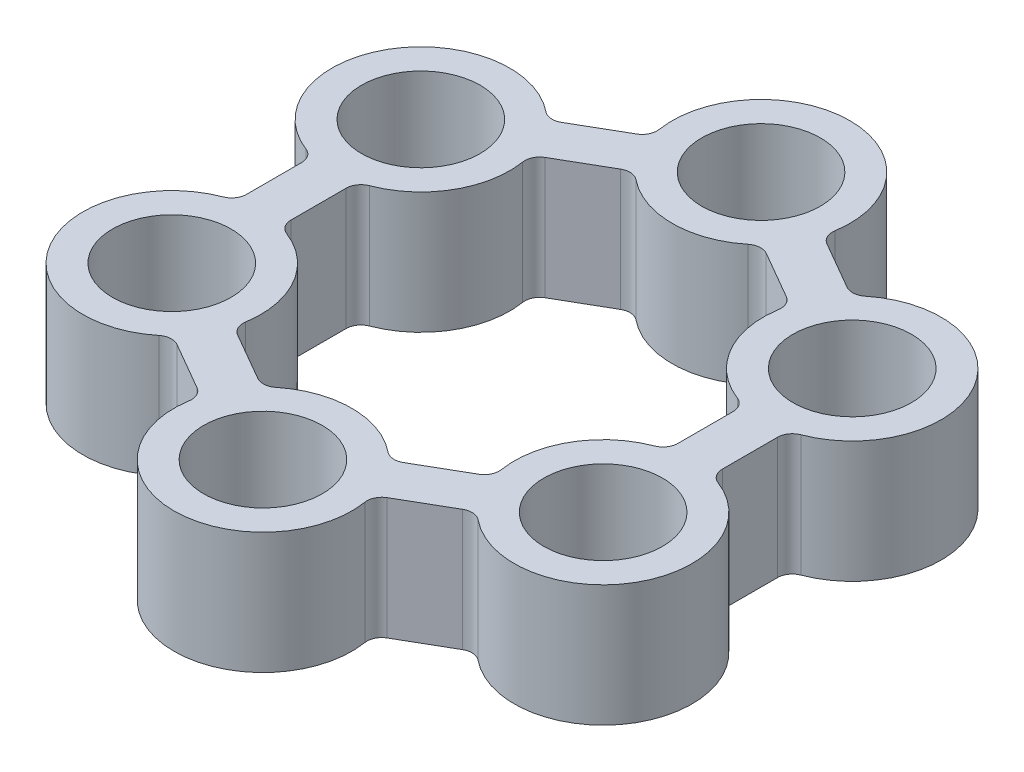
from build123d import *

# Parameters (mm, degrees)
SKETCH1_R           = 3
SKETCH1_R_2         = 2
BOSS_EXTRUDE1_DEPTH = 2.05
CIRPATTERN7_COUNT   = 6
BOSS_EXTRUDE4_DEPTH = 4.1
CIRPATTERN8_COUNT   = 6
FILLET3_R           = 0.5


with BuildPart() as part:
    # Sketch1 → Boss-Extrude1 (new, symmetric)
    with BuildSketch(Plane(origin=(0, 0, 0), x_dir=(1, 0, 0), z_dir=(0, 1, 0))):
        with Locations(Location((0, 8.4, 0), (0, 0, 270))):
            Circle(SKETCH1_R)
        with Locations(Location((0, 8.4, 0), (0, 0, 270))):
            Circle(SKETCH1_R_2, mode=Mode.SUBTRACT)
    extrude(amount=BOSS_EXTRUDE1_DEPTH, both=True)


with BuildPart() as cirpattern7_1:
    # CirPattern7: pattern copy
    add(part.part.rotate(Axis((0, 0, 0), (0, 1, 0)), 1 * 360 / CIRPATTERN7_COUNT))


with BuildPart() as cirpattern7_2:
    # CirPattern7: pattern copy
    add(part.part.rotate(Axis((0, 0, 0), (0, 1, 0)), 2 * 360 / CIRPATTERN7_COUNT))


with BuildPart() as cirpattern7_3:
    # CirPattern7: pattern copy
    add(part.part.rotate(Axis((0, 0, 0), (0, 1, 0)), 3 * 360 / CIRPATTERN7_COUNT))


with BuildPart() as cirpattern7_4:
    # CirPattern7: pattern copy
    add(part.part.rotate(Axis((0, 0, 0), (0, 1, 0)), 4 * 360 / CIRPATTERN7_COUNT))


with BuildPart() as cirpattern7_5:
    # CirPattern7: pattern copy
    add(part.part.rotate(Axis((0, 0, 0), (0, 1, 0)), 5 * 360 / CIRPATTERN7_COUNT))


with BuildPart() as part_1:
    add(part.part)

    # Sketch5 → Boss-Extrude4 (add)
    with BuildSketch(Plane(origin=(0, 2.05, 0), x_dir=(1, 0, 0), z_dir=(0, 1, 0))):
        with BuildLine():
            Line((-4.384036917, 5.002849702), (-2.140576475, 6.298112192))
            ThreePointArc((-2.140576475, 6.298112192), (-2.598076211, 6.9), (-2.890576475, 7.597150298))
            Line((-2.890576475, 7.597150298), (-5.134036917, 6.301887808))
            ThreePointArc((-5.134036917, 6.301887808), (-4.67653718, 5.7), (-4.384036917, 5.002849702))
        make_face()
    extrude(amount=-BOSS_EXTRUDE4_DEPTH)


with BuildPart() as cirpattern8_1:
    # CirPattern8: pattern copy
    add(part_1.part.rotate(Axis((0, 0, 0), (0, 1, 0)), 1 * 360 / CIRPATTERN8_COUNT))


with BuildPart() as cirpattern8_2:
    # CirPattern8: pattern copy
    add(part_1.part.rotate(Axis((0, 0, 0), (0, 1, 0)), 2 * 360 / CIRPATTERN8_COUNT))


with BuildPart() as cirpattern8_3:
    # CirPattern8: pattern copy
    add(part_1.part.rotate(Axis((0, 0, 0), (0, 1, 0)), 3 * 360 / CIRPATTERN8_COUNT))


with BuildPart() as cirpattern8_4:
    # CirPattern8: pattern copy
    add(part_1.part.rotate(Axis((0, 0, 0), (0, 1, 0)), 4 * 360 / CIRPATTERN8_COUNT))


with BuildPart() as cirpattern8_5:
    # CirPattern8: pattern copy
    add(part_1.part.rotate(Axis((0, 0, 0), (0, 1, 0)), 5 * 360 / CIRPATTERN8_COUNT))


with BuildPart() as cirpattern8_4_1:
    add(cirpattern8_4.part)

    # Combine1: read off the stored shape, not the designer's step
    # Combine1: union CirPattern7_5, CirPattern7_3, CirPattern7_2, CirPattern7_1, part, CirPattern8_5, CirPattern8_3, CirPattern8_2, CirPattern8_1, CirPattern7_4
    add(cirpattern7_5.part)
    add(cirpattern7_3.part)
    add(cirpattern7_2.part)
    add(cirpattern7_1.part)
    add(part_1.part)
    add(cirpattern8_5.part)
    add(cirpattern8_3.part)
    add(cirpattern8_2.part)
    add(cirpattern8_1.part)
    add(cirpattern7_4.part)

    # Fillet3
    fillet3_edges = [cirpattern8_4_1.edges().sort_by_distance(p)[0] for p in [
        (-8.024613392, 0, -1.29526249),
        (-4.384036917, 0, -5.002849702),
        (-8.024613392, 0, 1.29526249),
        (-6.524613392, 0, -1.29526249),
        (-6.524613392, 0, 1.29526249),
        (-5.134036917, 0, 6.301887808),
        (-2.890576475, 0, 7.597150298),
        (-4.384036917, 0, 5.002849702),
        (-2.140576475, 0, 6.298112192),
        (2.890576475, 0, 7.597150298),
        (5.134036917, 0, 6.301887808),
        (2.140576475, 0, 6.298112192),
        (4.384036917, 0, 5.002849702),
        (8.024613392, 0, 1.29526249),
        (8.024613392, 0, -1.29526249),
        (6.524613392, 0, 1.29526249),
        (6.524613392, 0, -1.29526249),
        (5.134036917, 0, -6.301887808),
        (2.890576475, 0, -7.597150298),
        (4.384036917, 0, -5.002849702),
        (2.140576475, 0, -6.298112192),
        (-2.890576475, 0, -7.597150298),
        (-5.134036917, 0, -6.301887808),
        (-2.140576475, 0, -6.298112192),
    ]]
    fillet(fillet3_edges, radius=FILLET3_R)


solid = cirpattern8_4_1.part
